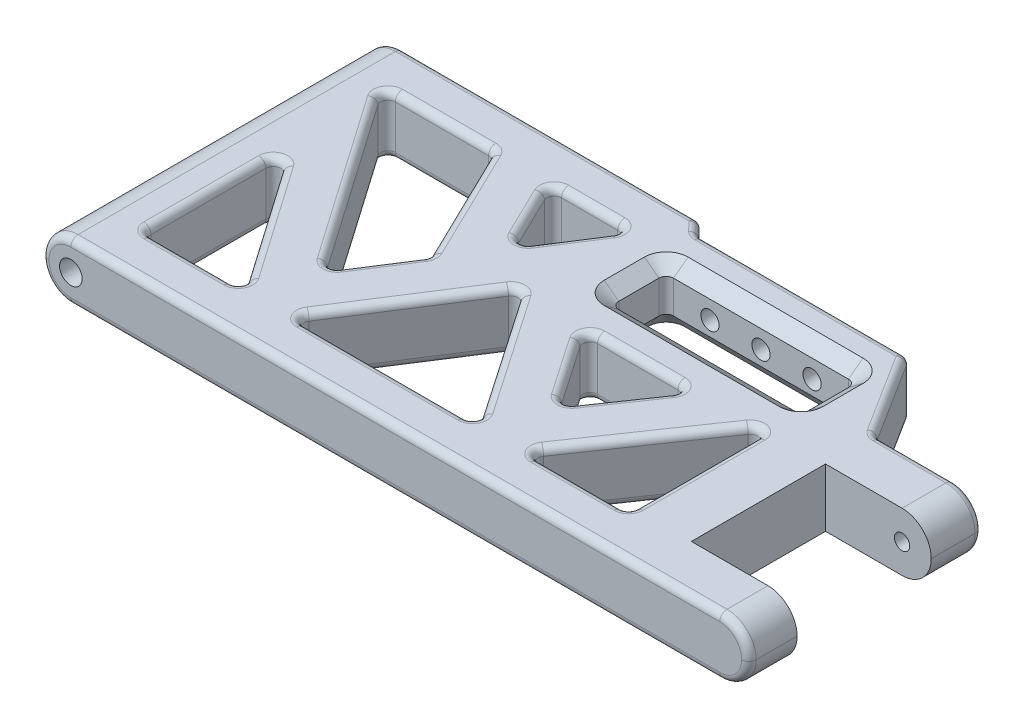
from build123d import *
from OCP.BRepFilletAPI import BRepFilletAPI_MakeChamfer

# Parameters (mm, degrees)
BOSS_EXTRU_1_DEPTH                            = 4
BOSS_EXTRU_1_DEPTH_BACK                       = 4
CONG_1_R                                      = 4
CONG_2_R                                      = 1
CHANFREIN2_SIZE                               = 2
CHANFREIN2_SIZE2                              = 1.5
ENL_V_MAT_EXTRU_1_DEPTH                       = 21.75
ENL_V_MAT_EXTRU_1_DEPTH_BACK                  = 100.712398932
ESQUISSE6_R                                   = 1.05
ENL_V_MAT_EXTRU_2_DEPTH                       = 100.712398932
ENL_V_MAT_EXTRU_2_DEPTH_BACK                  = 100.712398932
ESQUISSE10_R                                  = 1.55
TROU_TARAUD_M31_D                             = 2.5
TROU_TARAUD_M31_DEPTH                         = 18
TROU_TARAUD_M31_TIP                           = 0.751075774
TROU_POUR_TARAUDAGE_POUR_TROU_TARAUD_M3_D     = 2.7
TROU_POUR_TARAUDAGE_POUR_TROU_TARAUD_M3_DEPTH = 3
TROU_POUR_TARAUDAGE_POUR_TROU_TARAUD_M3_TIP   = 0.811161836


with BuildPart() as part:
    # Esquisse1 → Boss.-Extru.1 (new, two sides: drawn at the far end of the back side and taken through both)
    with BuildSketch(Plane(origin=(0, 0, 0), x_dir=(1, 0, 0), z_dir=(0, 1, 0)).offset(-BOSS_EXTRU_1_DEPTH_BACK)):
        with BuildLine():
            Line((97, 2.25), (97, 9.25))
            Line((97, 9.25), (83, 9.25))
            ThreePointArc((83, 9.25), (82.51741061, 9.374153278), (82.154651329, 9.715785039))
            Line((82.154651329, 9.715785039), (75.381179241, 20.434214961))
            ThreePointArc((75.381179241, 20.434214961), (75.01841996, 20.775846722), (74.53583057, 20.9))
            Line((74.53583057, 20.9), (46.908568545, 20.9))
            ThreePointArc((46.908568545, 20.9), (46.520604762, 20.978325381), (46.193415802, 21.201031793))
            Line((46.193415802, 21.201031793), (44.973721288, 22.448968207))
            ThreePointArc((44.973721288, 22.448968207), (44.646532328, 22.671674619), (44.258568545, 22.75))
            Line((44.258568545, 22.75), (0, 22.75))
            Line((0, 22.75), (0, -22.75))
            Line((0, -22.75), (97, -22.75))
            Line((97, -22.75), (97, -16.15))
            Line((97, -16.15), (82.5, -16.15))
            Line((82.5, -16.15), (82.5, 2.25))
            Line((82.5, 2.25), (97, 2.25))
        make_face()
        with BuildLine():
            Line((22.683352941, 16.185889894), (30.300244259, 0.45897749))
            ThreePointArc((30.300244259, 0.45897749), (30.398449517, -0.036797808), (30.241675801, -0.517276134))
            Line((30.241675801, -0.517276134), (25.707978771, -7.576957366))
            ThreePointArc((25.707978771, -7.576957366), (24.885234269, -8.036419018), (24.045895423, -7.608022207))
            Line((24.045895423, -7.608022207), (8.179348193, 15.178571429))
            ThreePointArc((8.179348193, 15.178571429), (8.11359474, 16.21291005), (9, 16.75))
            Line((9, 16.75), (21.783352941, 16.75))
            ThreePointArc((21.783352941, 16.75), (22.314441495, 16.597316321), (22.683352941, 16.185889894))
        make_face(mode=Mode.SUBTRACT)
        with BuildLine():
            Line((30.883352941, 15.314110106), (34.200959359, 8.464110106))
            ThreePointArc((34.200959359, 8.464110106), (35.041073954, 7.901794741), (35.942390901, 8.35963627))
            Line((35.942390901, 8.35963627), (40.341431542, 15.20963627))
            ThreePointArc((40.341431542, 15.20963627), (40.37760006, 16.229393508), (39.5, 16.75))
            Line((39.5, 16.75), (31.783352941, 16.75))
            ThreePointArc((31.783352941, 16.75), (30.93603662, 16.281088555), (30.883352941, 15.314110106))
        make_face(mode=Mode.SUBTRACT)
        with BuildLine():
            Line((20.787544132, -15.178571429), (9.820651807, 0.571428571))
            ThreePointArc((9.820651807, 0.571428571), (8.700543665, 0.954110006), (8, 0))
            Line((8, 0), (8, -15.75))
            ThreePointArc((8, -15.75), (8.292893219, -16.457106781), (9, -16.75))
            Line((9, -16.75), (19.966892325, -16.75))
            ThreePointArc((19.966892325, -16.75), (20.853297586, -16.21291005), (20.787544132, -15.178571429))
        make_face(mode=Mode.SUBTRACT)
        with BuildLine():
            Line((39.818019422, 1.44036373), (29.125460783, -15.20963627))
            ThreePointArc((29.125460783, -15.20963627), (29.089292265, -16.229393508), (29.966892325, -16.75))
            Line((29.966892325, -16.75), (52.079725482, -16.75))
            ThreePointArc((52.079725482, -16.75), (52.964494902, -16.216029049), (52.904381984, -15.184366148))
            Line((52.904381984, -15.184366148), (41.484107466, 1.465633852))
            ThreePointArc((41.484107466, 1.465633852), (40.64428537, 1.899884996), (39.818019422, 1.44036373))
        make_face(mode=Mode.SUBTRACT)
        with BuildLine():
            Line((50.74842939, 0.334366148), (56.25506898, -7.693947797))
            ThreePointArc((56.25506898, -7.693947797), (57.079725482, -8.128313946), (57.904381984, -7.693947797))
            Line((57.904381984, -7.693947797), (63.411021574, 0.334366148))
            ThreePointArc((63.411021574, 0.334366148), (63.471134492, 1.366029049), (62.586365072, 1.9))
            Line((62.586365072, 1.9), (51.573085892, 1.9))
            ThreePointArc((51.573085892, 1.9), (50.688316472, 1.366029049), (50.74842939, 0.334366148))
        make_face(mode=Mode.SUBTRACT)
        with BuildLine():
            Line((48.5, 15.4), (72.5, 15.4))
            ThreePointArc((72.5, 15.4), (73.207106781, 15.107106781), (73.5, 14.4))
            Line((73.5, 14.4), (73.5, 8.9))
            ThreePointArc((73.5, 8.9), (73.207106781, 8.192893219), (72.5, 7.9))
            Line((72.5, 7.9), (48.5, 7.9))
            ThreePointArc((48.5, 7.9), (47.792893219, 8.192893219), (47.5, 8.9))
            Line((47.5, 8.9), (47.5, 14.4))
            ThreePointArc((47.5, 14.4), (47.792893219, 15.107106781), (48.5, 15.4))
        make_face(mode=Mode.SUBTRACT)
        with BuildLine():
            Line((62.079725482, -16.75), (73.5, -16.75))
            ThreePointArc((73.5, -16.75), (74.207106781, -16.457106781), (74.5, -15.75))
            Line((74.5, -15.75), (74.5, 0.9))
            ThreePointArc((74.5, 0.9), (73.796094156, 1.855158757), (72.675343498, 1.465633852))
            Line((72.675343498, 1.465633852), (61.25506898, -15.184366148))
            ThreePointArc((61.25506898, -15.184366148), (61.194956062, -16.216029049), (62.079725482, -16.75))
        make_face(mode=Mode.SUBTRACT)
    extrude(amount=BOSS_EXTRU_1_DEPTH + BOSS_EXTRU_1_DEPTH_BACK)

    # Congé1
    cong_1_edges = [part.edges().sort_by_distance(p)[0] for p in [
        (0, 4, 0),
        (97, -4, -5.75),
        (97, -4, 19.45),
        (97, 4, 19.45),
        (97, 4, -5.75),
        (0, -4, 0),
    ]]
    fillet(cong_1_edges, radius=CONG_1_R - 0.0001)  # a hair under: the kernel refuses the full size

    # Congé2
    cong_2_edges = [part.edges().sort_by_distance(p)[0] for p in [
        (40.64428537, -4, -1.899884996),
        (47.194244725, -4, 6.859366148),
        (52.964494902, -4, 16.216029049),
        (41.023308904, -4, 16.75),
        (29.089292265, -4, 16.229393508),
        (34.471740103, -4, 6.88463627),
        (50.688316472, -4, -1.366029049),
        (57.079725482, -4, -1.9),
        (63.471134492, -4, -1.366029049),
        (60.657701779, -4, 3.679790825),
        (57.079725482, -4, 8.128313946),
        (53.501749185, -4, 3.679790825),
        (61.194956062, -4, 16.216029049),
        (66.965206239, -4, 6.859366148),
        (73.796094156, -4, -1.855158757),
        (74.5, -4, 7.425),
        (74.207106781, -4, 16.457106781),
        (67.789862741, -4, 16.75),
        (82.51741061, 4, -9.374153278),
        (78.767915285, 4, -15.075),
        (75.01841996, 4, -20.775846722),
        (60.722199558, 4, -20.9),
        (46.520604762, 4, -20.978325381),
        (45.583568545, 4, -21.825),
        (44.646532328, 4, -22.671674619),
        (24.129234273, 4, -22.75),
        (30.398449517, 4, 0.036797808),
        (26.4917986, 4, -8.322433692),
        (22.314441495, 4, -16.597316321),
        (15.39167647, 4, -16.75),
        (8.11359474, 4, -16.21291005),
        (16.112621808, 4, -3.785274611),
        (24.885234269, 4, 8.036419018),
        (27.974827286, 4, 4.04711675),
        (40.37760006, 4, -16.229393508),
        (35.64167647, 4, -16.75),
        (30.93603662, 4, -16.281088555),
        (32.54215615, 4, -11.889110106),
        (35.041073954, 4, -7.901794741),
        (38.141911221, 4, -11.78463627),
        (8.700543665, 4, -0.954110006),
        (8, 4, 7.875),
        (8.292893219, 4, 16.457106781),
        (14.483446163, 4, 16.75),
        (20.853297586, 4, 16.21291005),
        (15.304097969, 4, 7.303571429),
        (40.64428537, 4, -1.899884996),
        (34.471740103, 4, 6.88463627),
        (29.089292265, 4, 16.229393508),
        (41.023308904, 4, 16.75),
        (52.964494902, 4, 16.216029049),
        (47.194244725, 4, 6.859366148),
        (50.688316472, 4, -1.366029049),
        (53.501749185, 4, 3.679790825),
        (57.079725482, 4, 8.128313946),
        (60.657701779, 4, 3.679790825),
        (63.471134492, 4, -1.366029049),
        (57.079725482, 4, -1.9),
        (61.194956062, 4, 16.216029049),
        (67.789862741, 4, 16.75),
        (74.207106781, 4, 16.457106781),
        (74.5, 4, 7.425),
        (73.796094156, 4, -1.855158757),
        (66.965206239, 4, 6.859366148),
        (82.51741061, -4, -9.374153278),
        (78.767915285, -4, -15.075),
        (88.00005, 4, -9.25),
        (88.00005, -4, -9.25),
        (95.828456414, 2.828456414, -9.25),
        (95.828456414, -2.828456414, -9.25),
        (48.5, -4, 22.75),
        (48.5, 4, 22.75),
        (1.171543586, 2.828456414, 22.75),
        (1.171543586, -2.828456414, 22.75),
        (95.828456414, 2.828456414, 22.75),
        (95.828456414, -2.828456414, 22.75),
        (1.171543586, 2.828456414, -22.75),
        (1.171543586, -2.828456414, -22.75),
        (75.01841996, -4, -20.775846722),
        (60.722199558, -4, -20.9),
        (46.520604762, -4, -20.978325381),
        (45.583568545, -4, -21.825),
        (30.398449517, -4, 0.036797808),
        (27.974827286, -4, 4.04711675),
        (24.885234269, -4, 8.036419018),
        (16.112621808, -4, -3.785274611),
        (44.646532328, -4, -22.671674619),
        (8.11359474, -4, -16.21291005),
        (15.39167647, -4, -16.75),
        (22.314441495, -4, -16.597316321),
        (26.4917986, -4, -8.322433692),
        (24.129234273, -4, -22.75),
        (40.37760006, -4, -16.229393508),
        (38.141911221, -4, -11.78463627),
        (35.041073954, -4, -7.901794741),
        (32.54215615, -4, -11.889110106),
        (30.93603662, -4, -16.281088555),
        (35.64167647, -4, -16.75),
        (8.700543665, -4, -0.954110006),
        (15.304097969, -4, 7.303571429),
        (20.853297586, -4, 16.21291005),
        (14.483446163, -4, 16.75),
        (8.292893219, -4, 16.457106781),
        (8, -4, 7.875),
    ]]
    fillet(cong_2_edges, radius=CONG_2_R)

    # Chanfrein2: one chamfer whose edges measure the first distance from different faces: ONE call of the kernel's chamfer builder (chamfer() names one face for all edges)
    chanfrein2_edges_1 = [part.edges().sort_by_distance(p)[0] for p in [
        (47.792893219, -4, -15.107106781),
    ]]
    chanfrein2_side_1 = [part.faces().sort_by_distance(p)[0] for p in [
        (47.792893219, 0, -15.107106781),
    ]]
    chanfrein2_edges_2 = [part.edges().sort_by_distance(p)[0] for p in [
        (60.5, -4, -15.4),
    ]]
    chanfrein2_side_2 = [part.faces().sort_by_distance(p)[0] for p in [
        (60.5, 0, -15.4),
    ]]
    chanfrein2_edges_3 = [part.edges().sort_by_distance(p)[0] for p in [
        (73.207106781, -4, -15.107106781),
    ]]
    chanfrein2_side_3 = [part.faces().sort_by_distance(p)[0] for p in [
        (73.207106781, 0, -15.107106781),
    ]]
    chanfrein2_edges_4 = [part.edges().sort_by_distance(p)[0] for p in [
        (73.5, -4, -11.65),
    ]]
    chanfrein2_side_4 = [part.faces().sort_by_distance(p)[0] for p in [
        (73.5, 0, -11.65),
    ]]
    chanfrein2_edges_5 = [part.edges().sort_by_distance(p)[0] for p in [
        (73.207106781, -4, -8.192893219),
    ]]
    chanfrein2_side_5 = [part.faces().sort_by_distance(p)[0] for p in [
        (73.207106781, 0, -8.192893219),
    ]]
    chanfrein2_edges_6 = [part.edges().sort_by_distance(p)[0] for p in [
        (60.5, -4, -7.9),
    ]]
    chanfrein2_side_6 = [part.faces().sort_by_distance(p)[0] for p in [
        (60.5, 0, -7.9),
    ]]
    chanfrein2_edges_7 = [part.edges().sort_by_distance(p)[0] for p in [
        (47.792893219, -4, -8.192893219),
    ]]
    chanfrein2_side_7 = [part.faces().sort_by_distance(p)[0] for p in [
        (47.792893219, 0, -8.192893219),
    ]]
    chanfrein2_edges_8 = [part.edges().sort_by_distance(p)[0] for p in [
        (47.5, -4, -11.65),
    ]]
    chanfrein2_side_8 = [part.faces().sort_by_distance(p)[0] for p in [
        (47.5, 0, -11.65),
    ]]
    chanfrein2_edges_9 = [part.edges().sort_by_distance(p)[0] for p in [
        (47.792893219, 4, -15.107106781),
        (47.5, 4, -11.65),
        (47.792893219, 4, -8.192893219),
        (60.5, 4, -7.9),
        (73.207106781, 4, -8.192893219),
        (73.5, 4, -11.65),
        (73.207106781, 4, -15.107106781),
        (60.5, 4, -15.4),
    ]]
    chanfrein2_side_9 = [part.faces().sort_by_distance(p)[0] for p in [
        (46.904552552, 4, 0.676364115),
    ]]
    chanfrein2 = BRepFilletAPI_MakeChamfer(part.part.solid().wrapped)
    for e in chanfrein2_edges_1:
        chanfrein2.Add(CHANFREIN2_SIZE, CHANFREIN2_SIZE2, e.wrapped, chanfrein2_side_1[0].wrapped)  # the first distance lies on this face
    for e in chanfrein2_edges_2:
        chanfrein2.Add(CHANFREIN2_SIZE, CHANFREIN2_SIZE2, e.wrapped, chanfrein2_side_2[0].wrapped)  # the first distance lies on this face
    for e in chanfrein2_edges_3:
        chanfrein2.Add(CHANFREIN2_SIZE, CHANFREIN2_SIZE2, e.wrapped, chanfrein2_side_3[0].wrapped)  # the first distance lies on this face
    for e in chanfrein2_edges_4:
        chanfrein2.Add(CHANFREIN2_SIZE, CHANFREIN2_SIZE2, e.wrapped, chanfrein2_side_4[0].wrapped)  # the first distance lies on this face
    for e in chanfrein2_edges_5:
        chanfrein2.Add(CHANFREIN2_SIZE, CHANFREIN2_SIZE2, e.wrapped, chanfrein2_side_5[0].wrapped)  # the first distance lies on this face
    for e in chanfrein2_edges_6:
        chanfrein2.Add(CHANFREIN2_SIZE, CHANFREIN2_SIZE2, e.wrapped, chanfrein2_side_6[0].wrapped)  # the first distance lies on this face
    for e in chanfrein2_edges_7:
        chanfrein2.Add(CHANFREIN2_SIZE, CHANFREIN2_SIZE2, e.wrapped, chanfrein2_side_7[0].wrapped)  # the first distance lies on this face
    for e in chanfrein2_edges_8:
        chanfrein2.Add(CHANFREIN2_SIZE, CHANFREIN2_SIZE2, e.wrapped, chanfrein2_side_8[0].wrapped)  # the first distance lies on this face
    for e in chanfrein2_edges_9:
        chanfrein2.Add(CHANFREIN2_SIZE, CHANFREIN2_SIZE2, e.wrapped, chanfrein2_side_9[0].wrapped)  # the first distance lies on this face
    add(Compound.cast(chanfrein2.Shape()), mode=Mode.REPLACE)

    # Esquisse6 → Enlèv. mat.-Extru.1 (cut, two sides: drawn at the far end of the back side and taken through both)
    with BuildSketch(Plane.XY.offset(-ENL_V_MAT_EXTRU_1_DEPTH_BACK)):
        with Locations((93, 0)):
            Circle(ESQUISSE6_R)
    extrude(amount=ENL_V_MAT_EXTRU_1_DEPTH + ENL_V_MAT_EXTRU_1_DEPTH_BACK, mode=Mode.SUBTRACT)

    # Esquisse10 → Enlèv. mat.-Extru.2 (cut, two sides: drawn at the far end of the back side and taken through both)
    with BuildSketch(Plane.XY.offset(-ENL_V_MAT_EXTRU_2_DEPTH_BACK)):
        with Locations((4, 0)):
            Circle(ESQUISSE10_R)
    extrude(amount=ENL_V_MAT_EXTRU_2_DEPTH + ENL_V_MAT_EXTRU_2_DEPTH_BACK, mode=Mode.SUBTRACT)

    # Trou taraudé M31
    with Locations(Plane(origin=(0, 0, -20.9), x_dir=(-1, 0, 0), z_dir=(0, 0, -1))):
        with Locations((-60.5, 0), (-53.5, 0), (-67.5, 0)):
            Hole(TROU_TARAUD_M31_D / 2, depth=TROU_TARAUD_M31_DEPTH)
            with Locations((0, 0, -(TROU_TARAUD_M31_DEPTH + TROU_TARAUD_M31_TIP / 2))):  # 118° drill point
                Cone(0, TROU_TARAUD_M31_D / 2, TROU_TARAUD_M31_TIP, mode=Mode.SUBTRACT)

    # Trou pour taraudage pour trou taraudé M31
    with Locations(Plane(origin=(0, 0, -9.25), x_dir=(-1, 0, 0), z_dir=(0, 0, -1))):
        with Locations((-93, 0)):
            Hole(TROU_POUR_TARAUDAGE_POUR_TROU_TARAUD_M3_D / 2, depth=TROU_POUR_TARAUDAGE_POUR_TROU_TARAUD_M3_DEPTH)
            with Locations((0, 0, -(TROU_POUR_TARAUDAGE_POUR_TROU_TARAUD_M3_DEPTH + TROU_POUR_TARAUDAGE_POUR_TROU_TARAUD_M3_TIP / 2))):  # 118° drill point
                Cone(0, TROU_POUR_TARAUDAGE_POUR_TROU_TARAUD_M3_D / 2, TROU_POUR_TARAUDAGE_POUR_TROU_TARAUD_M3_TIP, mode=Mode.SUBTRACT)


solid = part.part
